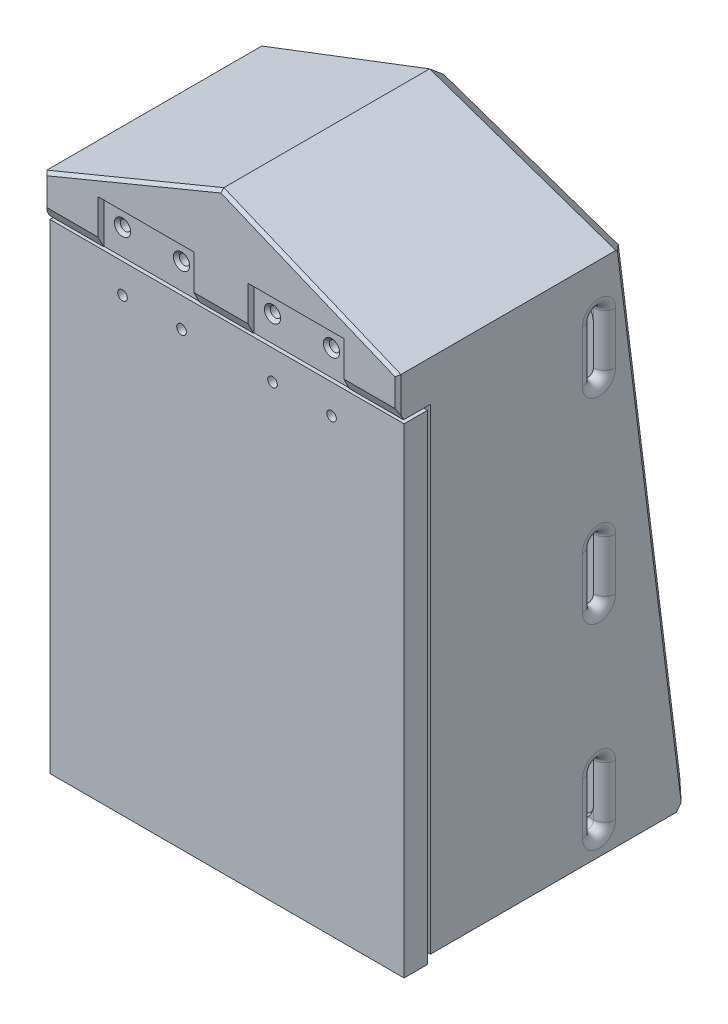
from build123d import *
from OCP.BRepFilletAPI import BRepFilletAPI_MakeChamfer

# Parameters (mm, degrees)
SKETCH1_W                 = 90
SKETCH1_H                 = 123.117749006
MAIN_EXTRUDE_DEPTH        = 60
REAR_EXTRUDE_DEPTH        = 20
REAR_ANGLE_CUT_DEPTH      = 121.976212266
REAR_ANGLE_CUT_DEPTH_BACK = 121.976212266
SKETCH9_R                 = 3
INNER_DRAIN_HOLES_DEPTH   = 15
CUT_EXTRUDE2_DEPTH        = 8
SKETCH5_W                 = 26
SKETCH5_H                 = 27
CUT_EXTRUDE3_DEPTH        = 1.65
SKETCH15_R                = 1.4
CUT_EXTRUDE7_DEPTH        = 40
SKETCH12_W                = 96.002
SKETCH12_H                = 130.117749006
BOSS_EXTRUDE5_DEPTH       = 6.35
SKETCH13_R                = 1.3
CUT_EXTRUDE8_DEPTH        = 132.049847139
CHAMFER4_SIZE             = 3
CHAMFER4_SIZE2            = 1.5
CHAMFER7_SIZE             = 0.8
CAVITY_FILLET_R           = 5
SKETCH21_R                = 1.3
BOSS_EXTRUDE10_DEPTH      = 3
SKETCH22_R                = 2
CUT_EXTRUDE11_DEPTH       = 121.976609041
CHAMFER6_SIZE             = 0.8
CHAMFER9_SIZE             = 0.8
CUT_EXTRUDE12_DEPTH       = 121.976609041
CUT_EXTRUDE12_DEPTH_BACK  = 121.976609041
FILLET3_R                 = 3
CHAMFER10_SIZE            = 5
CHAMFER10_SIZE2           = 4.479032082
CHAMFER11_SIZE            = 3
CHAMFER11_SIZE2           = 3.413670835


with BuildPart() as part:
    # Sketch1 → main-extrude (new body)
    with BuildSketch(Plane.XY):
        Polygon((-48, 73.558874503), (-48, -66.558874503), (48, -66.558874503), (48, 73.558874503), (0, 93.441125497), align=None)
        Rectangle(SKETCH1_W, SKETCH1_H, mode=Mode.SUBTRACT)
    extrude(amount=MAIN_EXTRUDE_DEPTH)

    # Sketch2 → rear-extrude (add)
    with BuildSketch(Plane.XY):
        Polygon((48, -66.558874503), (48, 73.558874503), (0, 93.441125497), (-48, 73.558874503), (-48, -66.558874503), align=None)
    extrude(amount=-REAR_EXTRUDE_DEPTH)

    # Sketch24 → rear-angle-cut (cut, two sides: drawn at the far end of the back side and taken through both)
    with BuildSketch(Plane(origin=(0, 0, 0), x_dir=(0, 0, -1), z_dir=(1, 0, 0)).offset(-REAR_ANGLE_CUT_DEPTH_BACK)):
        Polygon((0, 93.441125497), (20, -66.558874503), (20, 93.441125497), align=None)
    extrude(amount=REAR_ANGLE_CUT_DEPTH + REAR_ANGLE_CUT_DEPTH_BACK, mode=Mode.SUBTRACT)

    # Sketch9 → inner-drain-holes (cut)
    with BuildSketch(Plane.XZ.offset(66.558874503)):
        with Locations(Location((-30, 3, 0), (0, 0, 270))):
            Circle(SKETCH9_R)
        with Locations(Location((0, 3, 0), (0, 0, 270))):
            Circle(SKETCH9_R)
        with Locations(Location((30, 3, 0), (0, 0, 270))):
            Circle(SKETCH9_R)
    extrude(amount=-INNER_DRAIN_HOLES_DEPTH, mode=Mode.SUBTRACT)

    # Sketch4 → Cut-Extrude2 (cut)
    with BuildSketch(Plane.XY.offset(60)):
        Polygon((-48, 61.558874503), (-48, -66.558874503), (48, -66.558874503), (48, 61.558874503), (48, 62.558874503), (-48, 62.558874503), align=None)
    extrude(amount=-CUT_EXTRUDE2_DEPTH, mode=Mode.SUBTRACT)

    # Sketch5 → Cut-Extrude3 (cut)
    with BuildSketch(Plane.XY.offset(60)):
        with Locations((-20.333333333, 61.558874503)):
            Rectangle(SKETCH5_W, SKETCH5_H)
        with Locations((20.333333333, 61.558874503)):
            Rectangle(SKETCH5_W, SKETCH5_H)
    extrude(amount=-CUT_EXTRUDE3_DEPTH, mode=Mode.SUBTRACT)

    # Sketch15 → Cut-Extrude7 (cut)
    with BuildSketch(Plane.XY.offset(58.35)):
        with Locations((-28.333333333, 69.558874503)):
            Circle(SKETCH15_R)
        with Locations((-12.333333333, 69.558874503)):
            Circle(SKETCH15_R)
        with Locations(Location((28.333333333, 69.558874503, 0), (0, 0, 180))):
            Circle(SKETCH15_R)
        with Locations(Location((12.333333333, 69.558874503, 0), (0, 0, 180))):
            Circle(SKETCH15_R)
    extrude(amount=-CUT_EXTRUDE7_DEPTH, mode=Mode.SUBTRACT)

    # Chamfer4
    chamfer4_edges = [part.edges().sort_by_distance(p)[0] for p in [
        (0, 62.558874503, 60),
        (-40.666666667, 62.558874503, 60),
        (40.666666667, 62.558874503, 60),
    ]]
    chamfer4_side = [part.faces().sort_by_distance(p)[0] for p in [
        (0, 76.208462952, 60),
    ]]
    chamfer(chamfer4_edges, length=CHAMFER4_SIZE, length2=CHAMFER4_SIZE2, reference=chamfer4_side[0])

    # Chamfer7
    chamfer7_edges = [part.edges().sort_by_distance(p)[0] for p in [
        (-29.733333333, 69.558874503, 58.35),
        (13.733333333, 69.558874503, 58.35),
        (29.733333333, 69.558874503, 58.35),
        (-13.733333333, 69.558874503, 58.35),
    ]]
    chamfer(chamfer7_edges, length=CHAMFER7_SIZE)

    # cavity-fillet
    cavity_fillet_edges = [part.edges().sort_by_distance(p)[0] for p in [
        (-45, -61.558874503, 26),
        (45, -61.558874503, 26),
        (-45, 61.558874503, 26),
        (45, 61.558874503, 26),
    ]]
    fillet(cavity_fillet_edges, radius=CAVITY_FILLET_R)

    # Sketch22 → Cut-Extrude11 (cut, through all)
    with BuildSketch(Plane.XY):
        with Locations((-38.5, 55.058874503)):
            Circle(SKETCH22_R)
        with Locations((38.5, 55.058874503)):
            Circle(SKETCH22_R)
        with Locations((-38.5, -55.058874503)):
            Circle(SKETCH22_R)
        with Locations((38.5, -55.058874503)):
            Circle(SKETCH22_R)
    extrude(amount=-CUT_EXTRUDE11_DEPTH, mode=Mode.SUBTRACT)

    # Chamfer6
    chamfer6_edges = [part.edges().sort_by_distance(p)[0] for p in [
        (0, -61.558874503, 52),
        (45, 0, 52),
        (-45, 0, 52),
        (0, 61.558874503, 52),
        (43.535533906, -60.094408409, 52),
        (-43.535533906, -60.094408409, 52),
        (43.535533906, 60.094408409, 52),
        (-43.535533906, 60.094408409, 52),
        (48, -2, 52),
        (0, -66.558874503, 52),
        (-48, -2, 52),
    ]]
    chamfer(chamfer6_edges, length=CHAMFER6_SIZE)

    # Chamfer9
    chamfer9_edges = [part.edges().sort_by_distance(p)[0] for p in [
        (24, 83.5, 60),
        (48, 69.558874503, 60),
        (-24, 83.5, 60),
        (-48, 69.558874503, 60),
    ]]
    chamfer(chamfer9_edges, length=CHAMFER9_SIZE)

    # Sketch23 → Cut-Extrude12 (cut, two sides: drawn at the far end of the back side and taken through both)
    with BuildSketch(Plane(origin=(0, 0, 0), x_dir=(0, 0, -1), z_dir=(1, 0, 0)).offset(-CUT_EXTRUDE12_DEPTH_BACK)):
        with BuildLine():
            Line((-7, 46.058874503), (-7, 60.058874503))
            ThreePointArc((-7, 60.058874503), (-5.5, 61.558874503), (-4, 60.058874503))
            Line((-4, 60.058874503), (-4, 46.058874503))
            ThreePointArc((-4, 46.058874503), (-5.5, 44.558874503), (-7, 46.058874503))
        make_face()
        with BuildLine():
            Line((-7, -60.058874503), (-7, -46.058874503))
            ThreePointArc((-7, -46.058874503), (-5.5, -44.558874503), (-4, -46.058874503))
            Line((-4, -46.058874503), (-4, -60.058874503))
            ThreePointArc((-4, -60.058874503), (-5.5, -61.558874503), (-7, -60.058874503))
        make_face()
        with BuildLine():
            Line((-4, 7), (-4, -7))
            ThreePointArc((-4, -7), (-5.5, -8.5), (-7, -7))
            Line((-7, -7), (-7, 7))
            ThreePointArc((-7, 7), (-5.5, 8.5), (-4, 7))
        make_face()
    extrude(amount=CUT_EXTRUDE12_DEPTH + CUT_EXTRUDE12_DEPTH_BACK, mode=Mode.SUBTRACT)

    # Fillet3
    fillet3_edges = [part.edges().sort_by_distance(p)[0] for p in [
        (48, -44.558874503, 5.5),
        (48, -53.058874503, 7),
        (48, -61.558874503, 5.5),
        (48, 61.558874503, 5.5),
        (48, 53.058874503, 7),
        (48, 44.558874503, 5.5),
        (-48, 44.558874503, 5.5),
        (-48, 53.058874503, 7),
        (-48, 61.558874503, 5.5),
        (-48, -61.558874503, 5.5),
        (-48, -53.058874503, 7),
        (-48, -44.558874503, 5.5),
        (48, -53.058874503, 4),
        (48, 53.058874503, 4),
        (-48, 53.058874503, 4),
        (-48, -53.058874503, 4),
        (-48, -8.5, 5.5),
        (-48, 0, 7),
        (-48, 8.5, 5.5),
        (48, 8.5, 5.5),
        (48, 0, 7),
        (48, -8.5, 5.5),
        (-48, 0, 4),
        (48, 0, 4),
    ]]
    fillet(fillet3_edges, radius=FILLET3_R - 0.0001)  # a hair under: the kernel refuses the full size

    # Chamfer10
    chamfer10_edges = [part.edges().sort_by_distance(p)[0] for p in [
        (0, -66.558874503, -20),
    ]]
    chamfer10_side = [part.faces().sort_by_distance(p)[0] for p in [
        (0, 8.610370377, -10.60384439),
    ]]
    chamfer(chamfer10_edges, length=CHAMFER10_SIZE, length2=CHAMFER10_SIZE2, reference=chamfer10_side[0])

    # Chamfer11: one chamfer whose edges measure the first distance from different faces: ONE call of the kernel's chamfer builder (chamfer() names one face for all edges)
    chamfer11_edges_1 = [part.edges().sort_by_distance(p)[0] for p in [
        (24, 83.5, -1.242640687),
        (-24, 83.5, -1.242640687),
    ]]
    chamfer11_side_1 = [part.faces().sort_by_distance(p)[0] for p in [
        (0, 11.104847148, -10.292034794),
    ]]
    chamfer11_edges_2 = [part.edges().sort_by_distance(p)[0] for p in [
        (-48, 5.980694692, -10.932553851),
        (48, 5.980694692, -10.932553851),
    ]]
    chamfer11 = BRepFilletAPI_MakeChamfer(part.part.solid().wrapped)
    for e in chamfer11_edges_1:
        chamfer11.Add(CHAMFER11_SIZE, CHAMFER11_SIZE2, e.wrapped, chamfer11_side_1[0].wrapped)  # the first distance lies on this face
    for e in chamfer11_edges_2:
        chamfer11.Add(CHAMFER11_SIZE, e.wrapped)
    add(Compound.cast(chamfer11.Shape()), mode=Mode.REPLACE)


with BuildPart() as body_2:
    # Sketch12 → Boss-Extrude5 (new body)
    with BuildSketch(Plane.XY.offset(52)):
        with Locations((0, -3.5)):
            Rectangle(SKETCH12_W, SKETCH12_H)
    extrude(amount=BOSS_EXTRUDE5_DEPTH)

    # Sketch13 → Cut-Extrude8 (cut, through all)
    with BuildSketch(Plane.XY.offset(58.35)):
        with Locations((-28.333333333, 53.558874503)):
            Circle(SKETCH13_R)
        with Locations((-12.333333333, 53.558874503)):
            Circle(SKETCH13_R)
        with Locations((12.333333333, 53.558874503)):
            Circle(SKETCH13_R)
        with Locations((28.333333333, 53.558874503)):
            Circle(SKETCH13_R)
    extrude(amount=-CUT_EXTRUDE8_DEPTH, mode=Mode.SUBTRACT)


with BuildPart() as body_3:
    # Sketch21 → Boss-Extrude10 (new body)
    with BuildSketch(Plane.XY):
        with BuildLine():
            Line((30, -61.058874503), (40, -61.058874503))
            ThreePointArc((40, -61.058874503), (43.181980515, -59.740855018), (44.5, -56.558874503))
            Line((44.5, -56.558874503), (44.5, 56.558874503))
            ThreePointArc((44.5, 56.558874503), (43.181980515, 59.740855018), (40, 61.058874503))
            Line((40, 61.058874503), (-40, 61.058874503))
            ThreePointArc((-40, 61.058874503), (-43.181980515, 59.740855018), (-44.5, 56.558874503))
            Line((-44.5, 56.558874503), (-44.5, -56.558874503))
            ThreePointArc((-44.5, -56.558874503), (-43.181980515, -59.740855018), (-40, -61.058874503))
            Line((-40, -61.058874503), (-30, -61.058874503))
            Line((-30, -61.058874503), (0, -61.058874503))
            Line((0, -61.058874503), (30, -61.058874503))
        make_face()
        with Locations((-38.5, 55.058874503)):
            Circle(SKETCH21_R, mode=Mode.SUBTRACT)
        with Locations((38.5, 55.058874503)):
            Circle(SKETCH21_R, mode=Mode.SUBTRACT)
        with Locations((-38.5, -55.058874503)):
            Circle(SKETCH21_R, mode=Mode.SUBTRACT)
        with Locations((38.5, -55.058874503)):
            Circle(SKETCH21_R, mode=Mode.SUBTRACT)
    extrude(amount=BOSS_EXTRUDE10_DEPTH)


solid = Compound([part.part, body_2.part, body_3.part])
